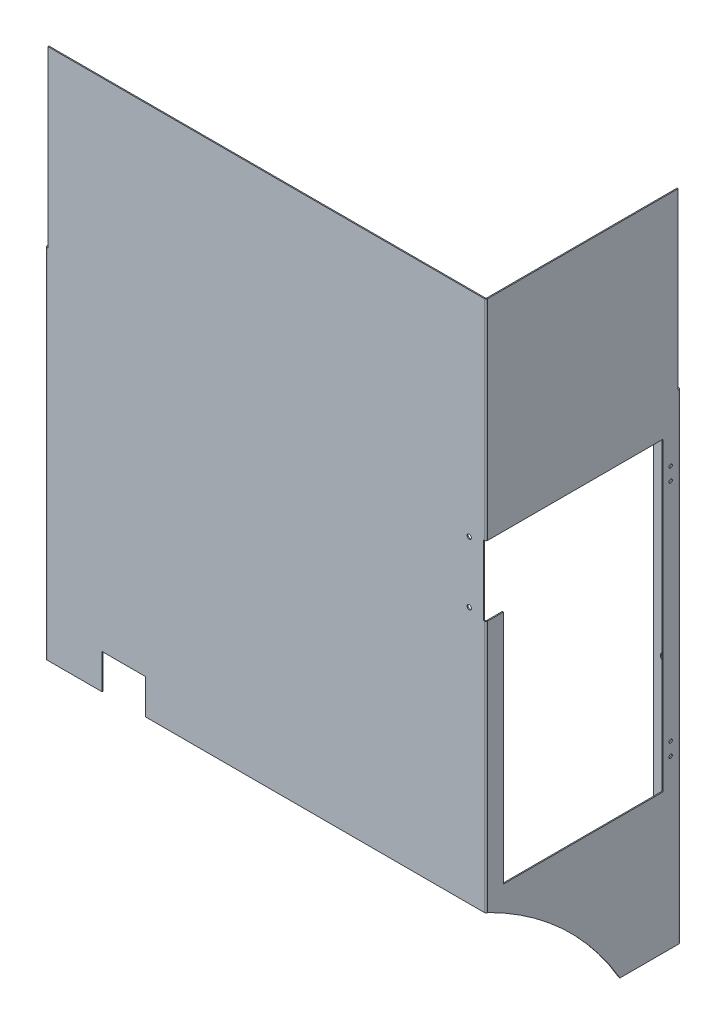
from build123d import *

# Parameters (mm, degrees)
SKETCH_1_W                       = 505
SKETCH_1_H                       = 750
SM_BASE_FLANGE_1_DEPTH           = 1.2
SM_EDGE_FLANGE_1_STRIP_W         = 6.2732
SM_EDGE_FLANGE_1_STRIP_H         = 1.2
SM_EDGE_FLANGE_1_STRIP_CUT_DEPTH = 750
SM_EDGE_FLANGE_1_DEPTH           = 750
CUT_EXTRUDE_1_DEPTH              = 932.264731427
SM_EDGE_FLANGE_2_STRIP_W         = 6.2732
SM_EDGE_FLANGE_2_STRIP_H         = 1.2
SM_EDGE_FLANGE_2_STRIP_CUT_DEPTH = 750
SM_EDGE_FLANGE_2_DEPTH           = 750
SM_EDGE_FLANGE_3_STRIP_W         = 6.2732
SM_EDGE_FLANGE_3_STRIP_H         = 1.2
SM_EDGE_FLANGE_3_STRIP_CUT_DEPTH = 609.290401588
SM_EDGE_FLANGE_3_DEPTH           = 609.290401588
SKETCH_16_W                      = 41.475289024
SKETCH_16_H                      = 200
CUT_EXTRUDE_2_DEPTH              = 932.264731427
SKETCH_17_W                      = 35.547342431
SKETCH_17_H                      = 200
CUT_EXTRUDE_3_DEPTH              = 932.264731427
CHAMFER_1_SIZE                   = 10
SKETCH_19_W                      = 183
SKETCH_19_H                      = 350
CUT_EXTRUDE_4_DEPTH              = 10
SKETCH_20_W                      = 20
SKETCH_20_H                      = 80
CUT_EXTRUDE_5_DEPTH              = 3
CUT_EXTRUDE_6_REACH              = 933.265
SKETCH_21_R                      = 2.5
CUT_EXTRUDE_7_REACH              = 933.265
SKETCH_22_R                      = 2
SKETCH_23_R                      = 4
CUT_EXTRUDE_8_DEPTH              = 10
CUT_EXTRUDE_9_REACH              = 933.265
SKETCH_24_R                      = 4
SKETCH_25_W                      = 50
SKETCH_25_H                      = 40
CUT_EXTRUDE_10_DEPTH             = 10


# Sheet-metal steps are written as plain solids
with BuildPart() as part:
    # Sketch 1 → Базовая кромка1 (new body)
    with BuildSketch(Plane.XY):
        with Locations((252.5, 375)):
            Rectangle(SKETCH_1_W, SKETCH_1_H)
    extrude(amount=-SM_BASE_FLANGE_1_DEPTH)

    # Ребро-кромка1 strip (across the edge) → Ребро-кромка1 strip cut (cut)
    with BuildSketch(Plane(origin=(505, 750, -1.2), x_dir=(-1, 0, 0), z_dir=(0, -1, 0))):
        with Locations((-1.2, -0.6)):
            Rectangle(SM_EDGE_FLANGE_1_STRIP_W, SM_EDGE_FLANGE_1_STRIP_H)
    extrude(amount=SM_EDGE_FLANGE_1_STRIP_CUT_DEPTH, mode=Mode.SUBTRACT)

    # Ребро-кромка1 section (across the edge) → Ребро-кромка1 (add)
    with BuildSketch(Plane(origin=(505, 750, -1.2), x_dir=(-1, 0, 0), z_dir=(0, -1, 0))):
        with BuildLine():
            Line((0, 0.7366), (0, 221.8))
            Line((0, 221.8), (1.2, 221.8))
            Line((1.2, 221.8), (1.2, 0.7366))
            ThreePointArc((1.2, 0.7366), (1.415745145, 0.215745145), (1.9366, 0))
            Line((1.9366, 0), (1.9366, -1.2))
            ThreePointArc((1.9366, -1.2), (0.567217008, -0.632782992), (0, 0.7366))
        make_face()
    extrude(amount=SM_EDGE_FLANGE_1_DEPTH)

    # Эскиз9 → Вырез-Вытянуть1 (cut, through all)
    with BuildSketch(Plane(origin=(505, 0, 0), x_dir=(0, 0, -1), z_dir=(1, 0, 0))):
        with BuildLine():
            Line((1.9366, 140.709598412), (-18.72453306, 140.709598412))
            Line((-18.72453306, 140.709598412), (-18.72453306, 150.079036589))
            ThreePointArc((-18.72453306, 150.079036589), (-305.67985666, -510.169358417), (1.9366, 140.709598412))
        make_face()
    extrude(amount=-CUT_EXTRUDE_1_DEPTH, mode=Mode.SUBTRACT)

    # Ребро-кромка2 strip (across the edge) → Ребро-кромка2 strip cut (cut)
    with BuildSketch(Plane(origin=(503.8, 750, -223), x_dir=(0, 0, 1), z_dir=(0, -1, 0))):
        with Locations((-1.2, -0.6)):
            Rectangle(SM_EDGE_FLANGE_2_STRIP_W, SM_EDGE_FLANGE_2_STRIP_H)
    extrude(amount=SM_EDGE_FLANGE_2_STRIP_CUT_DEPTH, mode=Mode.SUBTRACT)

    # Ребро-кромка2 section (across the edge) → Ребро-кромка2 (add)
    with BuildSketch(Plane(origin=(503.8, 750, -223), x_dir=(0, 0, 1), z_dir=(0, -1, 0))):
        with BuildLine():
            Line((0, 0.7366), (0, 28.8))
            Line((0, 28.8), (1.2, 28.8))
            Line((1.2, 28.8), (1.2, 0.7366))
            ThreePointArc((1.2, 0.7366), (1.415745145, 0.215745145), (1.9366, 0))
            Line((1.9366, 0), (1.9366, -1.2))
            ThreePointArc((1.9366, -1.2), (0.567217008, -0.632782992), (0, 0.7366))
        make_face()
    extrude(amount=SM_EDGE_FLANGE_2_DEPTH)

    # Ребро-кромка3 strip (across the edge) → Ребро-кромка3 strip cut (cut)
    with BuildSketch(Plane(origin=(0, 140.709598412, -1.2), x_dir=(1, 0, 0), z_dir=(0, 1, 0))):
        with Locations((-1.2, -0.6)):
            Rectangle(SM_EDGE_FLANGE_3_STRIP_W, SM_EDGE_FLANGE_3_STRIP_H)
    extrude(amount=SM_EDGE_FLANGE_3_STRIP_CUT_DEPTH, mode=Mode.SUBTRACT)

    # Ребро-кромка3 section (across the edge) → Ребро-кромка3 (add)
    with BuildSketch(Plane(origin=(0, 140.709598412, -1.2), x_dir=(1, 0, 0), z_dir=(0, 1, 0))):
        with BuildLine():
            Line((0, 0.7366), (0, 28.8))
            Line((0, 28.8), (1.2, 28.8))
            Line((1.2, 28.8), (1.2, 0.7366))
            ThreePointArc((1.2, 0.7366), (1.415745145, 0.215745145), (1.9366, 0))
            Line((1.9366, 0), (1.9366, -1.2))
            ThreePointArc((1.9366, -1.2), (0.567217008, -0.632782992), (0, 0.7366))
        make_face()
    extrude(amount=SM_EDGE_FLANGE_3_DEPTH)

    # Эскиз16 → Вырез-Вытянуть2 (cut, through all)
    with BuildSketch(Plane(origin=(505, 0, 0), x_dir=(0, 0, -1), z_dir=(1, 0, 0))):
        with Locations((240.737644512, 650)):
            Rectangle(SKETCH_16_W, SKETCH_16_H)
    extrude(amount=-CUT_EXTRUDE_2_DEPTH, mode=Mode.SUBTRACT)

    # Эскиз17 → Вырез-Вытянуть3 (cut, through all)
    with BuildSketch(Plane.XY):
        with Locations((-14.773671216, 650)):
            Rectangle(SKETCH_17_W, SKETCH_17_H)
    extrude(amount=-CUT_EXTRUDE_3_DEPTH, mode=Mode.SUBTRACT)

    # Фаска1
    chamfer_1_edges = [part.edges().sort_by_distance(p)[0] for p in [
        (0.6, 140.709598412, -30),
        (475, 550, -222.4),
        (0.6, 550, -30),
        (475, 0, -222.4),
    ]]
    chamfer(chamfer_1_edges, length=CHAMFER_1_SIZE)

    # Эскиз19 → Вырез-Вытянуть4 (cut)
    with BuildSketch(Plane(origin=(505, 0, 0), x_dir=(0, 0, -1), z_dir=(1, 0, 0))):
        with Locations((111.5, 335)):
            Rectangle(SKETCH_19_W, SKETCH_19_H)
    extrude(amount=-CUT_EXTRUDE_4_DEPTH, mode=Mode.SUBTRACT)

    # Эскиз20 → Вырез-Вытянуть5 (cut)
    with BuildSketch(Plane(origin=(505, 0, 0), x_dir=(0, 0, -1), z_dir=(1, 0, 0))):
        with Locations((10, 470)):
            Rectangle(SKETCH_20_W, SKETCH_20_H)
    extrude(amount=-CUT_EXTRUDE_5_DEPTH, mode=Mode.SUBTRACT)

    # Эскиз21 → Вырез-Вытянуть6 (cut, up to next)
    with BuildSketch(Plane.XY, mode=Mode.PRIVATE) as cut_extrude_6_sk1:
        with Locations((485.7, 505)):
            Circle(SKETCH_21_R)
    cut_extrude_6_tool1 = extrude(cut_extrude_6_sk1.sketch, amount=-CUT_EXTRUDE_6_REACH, mode=Mode.PRIVATE) & part.part
    # Эскиз21 → Вырез-Вытянуть6 (cut, up to next)
    with BuildSketch(Plane.XY, mode=Mode.PRIVATE) as cut_extrude_6_sk2:
        with Locations((485.7, 435)):
            Circle(SKETCH_21_R)
    cut_extrude_6_tool2 = extrude(cut_extrude_6_sk2.sketch, amount=-CUT_EXTRUDE_6_REACH, mode=Mode.PRIVATE) & part.part
    add(cut_extrude_6_tool1.solids().sort_by_distance((485.7, 505, 0))[0], mode=Mode.SUBTRACT)
    add(cut_extrude_6_tool2.solids().sort_by_distance((485.7, 435, 0))[0], mode=Mode.SUBTRACT)

    # Эскиз22 → Вырез-Вытянуть7 (cut, up to next)
    with BuildSketch(Plane(origin=(505, 0, 0), x_dir=(0, 0, -1), z_dir=(1, 0, 0)), mode=Mode.PRIVATE) as cut_extrude_7_sk1:
        with Locations((211.5, 479)):
            Circle(SKETCH_22_R)
    cut_extrude_7_tool1 = extrude(cut_extrude_7_sk1.sketch, amount=-CUT_EXTRUDE_7_REACH, mode=Mode.PRIVATE) & part.part
    # Эскиз22 → Вырез-Вытянуть7 (cut, up to next)
    with BuildSketch(Plane(origin=(505, 0, 0), x_dir=(0, 0, -1), z_dir=(1, 0, 0)), mode=Mode.PRIVATE) as cut_extrude_7_sk2:
        with Locations((211.5, 464)):
            Circle(SKETCH_22_R)
    cut_extrude_7_tool2 = extrude(cut_extrude_7_sk2.sketch, amount=-CUT_EXTRUDE_7_REACH, mode=Mode.PRIVATE) & part.part
    # Эскиз22 → Вырез-Вытянуть7 (cut, up to next)
    with BuildSketch(Plane(origin=(505, 0, 0), x_dir=(0, 0, -1), z_dir=(1, 0, 0)), mode=Mode.PRIVATE) as cut_extrude_7_sk3:
        with Locations((211.5, 206)):
            Circle(SKETCH_22_R)
    cut_extrude_7_tool3 = extrude(cut_extrude_7_sk3.sketch, amount=-CUT_EXTRUDE_7_REACH, mode=Mode.PRIVATE) & part.part
    # Эскиз22 → Вырез-Вытянуть7 (cut, up to next)
    with BuildSketch(Plane(origin=(505, 0, 0), x_dir=(0, 0, -1), z_dir=(1, 0, 0)), mode=Mode.PRIVATE) as cut_extrude_7_sk4:
        with Locations((211.5, 191)):
            Circle(SKETCH_22_R)
    cut_extrude_7_tool4 = extrude(cut_extrude_7_sk4.sketch, amount=-CUT_EXTRUDE_7_REACH, mode=Mode.PRIVATE) & part.part
    add(cut_extrude_7_tool1.solids().sort_by_distance((505, 479, -211.5))[0], mode=Mode.SUBTRACT)
    add(cut_extrude_7_tool2.solids().sort_by_distance((505, 464, -211.5))[0], mode=Mode.SUBTRACT)
    add(cut_extrude_7_tool3.solids().sort_by_distance((505, 206, -211.5))[0], mode=Mode.SUBTRACT)
    add(cut_extrude_7_tool4.solids().sort_by_distance((505, 191, -211.5))[0], mode=Mode.SUBTRACT)

    # Эскиз23 → Вырез-Вытянуть8 (cut)
    with BuildSketch(Plane(origin=(0, 0, -223), x_dir=(-1, 0, 0), z_dir=(0, 0, -1))):
        with Locations((-487, 510)):
            Circle(SKETCH_23_R)
        with Locations((-487, 275)):
            Circle(SKETCH_23_R)
        with Locations((-487, 40)):
            Circle(SKETCH_23_R)
    extrude(amount=-CUT_EXTRUDE_8_DEPTH, mode=Mode.SUBTRACT)

    # Эскиз24 → Вырез-Вытянуть9 (cut, up to next)
    with BuildSketch(Plane.ZY, mode=Mode.PRIVATE) as cut_extrude_9_sk1:
        with Locations((-18, 510)):
            Circle(SKETCH_24_R)
    cut_extrude_9_tool1 = extrude(cut_extrude_9_sk1.sketch, amount=-CUT_EXTRUDE_9_REACH, mode=Mode.PRIVATE) & part.part
    # Эскиз24 → Вырез-Вытянуть9 (cut, up to next)
    with BuildSketch(Plane.ZY, mode=Mode.PRIVATE) as cut_extrude_9_sk2:
        with Locations((-18, 345.354799206)):
            Circle(SKETCH_24_R)
    cut_extrude_9_tool2 = extrude(cut_extrude_9_sk2.sketch, amount=-CUT_EXTRUDE_9_REACH, mode=Mode.PRIVATE) & part.part
    # Эскиз24 → Вырез-Вытянуть9 (cut, up to next)
    with BuildSketch(Plane.ZY, mode=Mode.PRIVATE) as cut_extrude_9_sk3:
        with Locations((-18, 180.709598412)):
            Circle(SKETCH_24_R)
    cut_extrude_9_tool3 = extrude(cut_extrude_9_sk3.sketch, amount=-CUT_EXTRUDE_9_REACH, mode=Mode.PRIVATE) & part.part
    add(cut_extrude_9_tool1.solids().sort_by_distance((0, 510, -18))[0], mode=Mode.SUBTRACT)
    add(cut_extrude_9_tool2.solids().sort_by_distance((0, 345.354799, -18))[0], mode=Mode.SUBTRACT)
    add(cut_extrude_9_tool3.solids().sort_by_distance((0, 180.709598, -18))[0], mode=Mode.SUBTRACT)

    # Эскиз25 → Вырез-Вытянуть10 (cut)
    with BuildSketch(Plane.XY):
        with Locations((90, 160.709598412)):
            Rectangle(SKETCH_25_W, SKETCH_25_H)
    extrude(amount=-CUT_EXTRUDE_10_DEPTH, mode=Mode.SUBTRACT)


solid = part.part
